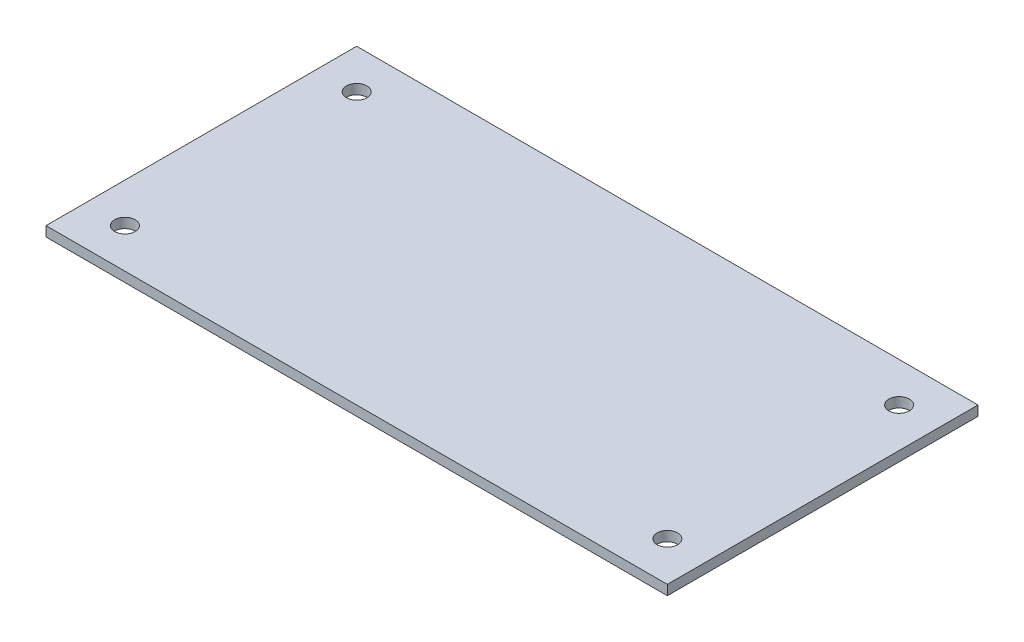
from build123d import *

# Parameters (mm, degrees)
SKETCH2_W                = 200
SKETCH2_H                = 100
BASE_FLANGE1_DEPTH       = 3.175
M6_CLEARANCE_HOLE1_D     = 6.6
M6_CLEARANCE_HOLE1_DEPTH = 18.75
M6_CLEARANCE_HOLE1_TIP   = 1.982840043


# Sheet-metal steps are written as plain solids
with BuildPart() as part:
    # Sketch2 (on Top Plane) → Base-Flange1 (new body)
    with BuildSketch(Plane(origin=(0, 0, 0), x_dir=(1, 0, 0), z_dir=(0, 1, 0))):
        Rectangle(SKETCH2_W, SKETCH2_H)
    extrude(amount=-BASE_FLANGE1_DEPTH)

    # M6 Clearance Hole1
    with Locations(Plane(origin=(0, 0, 0), x_dir=(1, 0, 0), z_dir=(0, 1, 0))):
        with Locations((-87.3, -37.3), (-87.3, 37.3), (87.3, 37.3), (87.3, -37.3)):
            Hole(M6_CLEARANCE_HOLE1_D / 2, depth=M6_CLEARANCE_HOLE1_DEPTH)
            with Locations((0, 0, -(M6_CLEARANCE_HOLE1_DEPTH + M6_CLEARANCE_HOLE1_TIP / 2))):  # 118° drill point
                Cone(0, M6_CLEARANCE_HOLE1_D / 2, M6_CLEARANCE_HOLE1_TIP, mode=Mode.SUBTRACT)


solid = part.part
